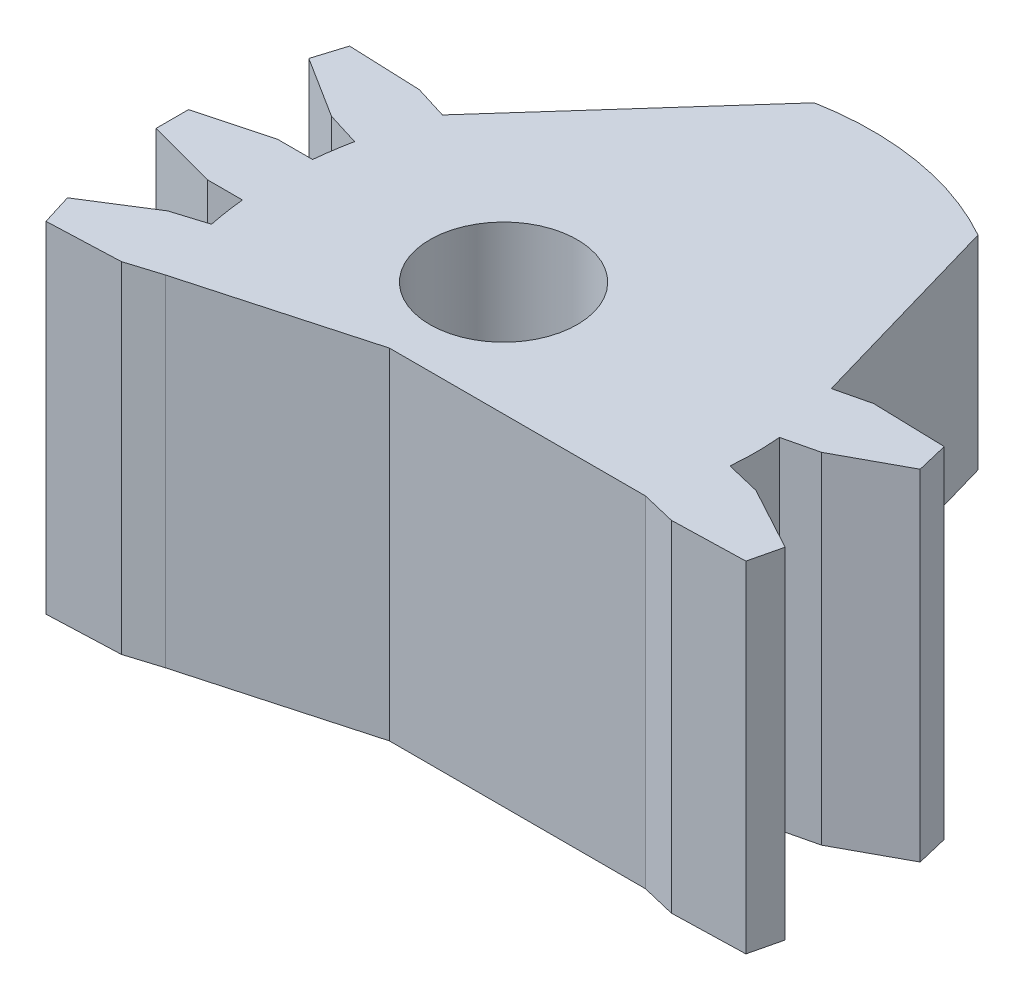
from build123d import *

# Parameters (mm, degrees)
BOSS_EXTRUDE1_DEPTH = 9.7
BOSS_EXTRUDE2_DEPTH = 5.8
CUT_EXTRUDE1_DEPTH  = 15.880557968
BOSS_EXTRUDE3_REACH = 16.881
CUT_EXTRUDE2_DEPTH  = 17.567792011
BOSS_EXTRUDE4_START = -9.7
BOSS_EXTRUDE4_DEPTH = 9.7
BOSS_EXTRUDE5_DEPTH = 5.8


# Read off the part's stored shape, not the designer's step: Boss-Extrude4
with BuildPart() as part:
    # Sketch1 → Boss-Extrude1 (new body)
    with BuildSketch(Plane(origin=(0, 0, 0), x_dir=(1, 0, 0), z_dir=(0, 1, 0))):
        Polygon((6.15, 2.65), (6.15, -2.65), (-1.15, -2.65), (-6.15, -4.038578044), (-6.15, 3.861421956), (-1.15, 3.861421956), align=None)
    extrude(amount=BOSS_EXTRUDE1_DEPTH)

    # Sketch2 → Boss-Extrude2 (add)
    with BuildSketch(Plane.XZ):
        Polygon((-6.15, -3.861421956), (-1.15, -9.461421956), (-1.15, -3.861421956), align=None)
        Polygon((-1.15, -3.861421956), (-1.15, -9.461421956), (4.45, -8.532111962), (4.45, -2.932111962), align=None)
        Polygon((4.45, -2.932111962), (4.45, -8.532111962), (6.15, -2.65), align=None)
    extrude(amount=-BOSS_EXTRUDE2_DEPTH)

    # Sketch3 → Cut-Extrude1 (cut, through all)
    with BuildSketch(Plane(origin=(0, 9.7, 0), x_dir=(1, 0, 0), z_dir=(0, 1, 0))):
        with BuildLine():
            ThreePointArc((0.95, 0.605710978), (0.33492424, 2.090635219), (-1.15, 2.705710978))
            Line((-1.15, 2.705710978), (-1.15, -1.494289022))
            ThreePointArc((-1.15, -1.494289022), (0.33492424, -0.879213262), (0.95, 0.605710978))
        make_face()
        with BuildLine():
            Line((-1.15, -1.494289022), (-1.15, 2.705710978))
            ThreePointArc((-1.15, 2.705710978), (-3.25, 0.605710978), (-1.15, -1.494289022))
        make_face()
    extrude(amount=-CUT_EXTRUDE1_DEPTH, mode=Mode.SUBTRACT)

    # Boss-Extrude3: up to this face of the body (flat: up to its plane)
    boss_extrude3_end = Plane(part.part.faces().sort_by_distance((0.174384558, 0, -2.694350329))[0])
    # Sketch4 → Boss-Extrude3 (add, up to the picked face)
    with BuildSketch(Plane(origin=(0, 9.7, 0), x_dir=(1, 0, 0), z_dir=(0, 1, 0)), mode=Mode.PRIVATE) as boss_extrude3_sk1:
        with BuildLine():
            Line((6.615749123, 0.704986439), (9.533269465, 1.403610124))
            Line((9.533269465, 1.403610124), (9.067520342, 3.348623685))
            Line((9.067520342, 3.348623685), (6.15, 2.65))
            Line((6.15, 2.65), (6.15, -2.65))
            Line((6.15, -2.65), (9.067520342, -3.348623685))
            Line((9.067520342, -3.348623685), (9.533269465, -1.403610124))
            Line((9.533269465, -1.403610124), (6.615749123, -0.704986439))
            ThreePointArc((6.615749123, -0.704986439), (6.65, 0), (6.615749123, 0.704986439))
        make_face()
    boss_extrude3_tool1 = split(extrude(boss_extrude3_sk1.sketch, amount=-BOSS_EXTRUDE3_REACH, mode=Mode.PRIVATE), bisect_by=boss_extrude3_end, keep=Keep.BOTH, mode=Mode.PRIVATE)
    add(boss_extrude3_tool1.solids().sort_by(Axis((6.574967, 9.7, 0), (0, -1, 0)))[0])

    # Sketch5 → Cut-Extrude2 (cut, through all)
    with BuildSketch(Plane(origin=(0, 9.7, 0), x_dir=(1, 0, 0), z_dir=(0, 1, 0))):
        Polygon((9.067520342, 3.348623685), (7.122506781, 2.882874562), (9.192317444, 2.827458872), align=None)
        Polygon((9.408472364, 1.924774937), (7.588255904, 0.937861), (9.533269465, 1.403610124), align=None)
        Polygon((9.408472364, -1.924774937), (9.533269465, -1.403610124), (7.588255904, -0.937861), align=None)
        Polygon((9.192317444, -2.827458872), (7.122506781, -2.882874562), (9.067520342, -3.348623685), align=None)
    extrude(amount=-CUT_EXTRUDE2_DEPTH, mode=Mode.SUBTRACT)

    # Boss-Extrude4 outline → Boss-Extrude4 (add)
    with BuildSketch(Plane(origin=(0, 9.7, 0), x_dir=(1, 0, 0), z_dir=(0, 1, 0)).offset(BOSS_EXTRUDE4_START)):
        with BuildLine():
            Line((-6.900626431, 0.911421956), (-7.900631816, 0.911421956))
            Line((-7.900631816, 0.911421956), (-9.900626719, 0.375520635))
            Line((-9.900626719, 0.375520635), (-9.900626431, -0.552684328))
            Line((-9.900626431, -0.552684328), (-7.900627802, -1.088578044))
            Line((-7.900627802, -1.088578044), (-6.900626431, -1.088578044))
            ThreePointArc((-6.900626431, -1.088578044), (-6.835256527, -1.610578376), (-6.742932214, -2.128491295))
            Line((-6.742932214, -2.128491295), (-7.697979422, -2.424958592))
            Line((-7.697979422, -2.424958592), (-9.449184507, -3.529703076))
            Line((-9.449184507, -3.529703076), (-9.1740036, -4.416177353))
            Line((-9.1740036, -4.416177353), (-7.105039542, -4.335042961))
            Line((-7.105039542, -4.335042961), (-6.15, -4.038578044))
            Line((-6.15, -4.038578044), (-6.15, 3.861421956))
            Line((-6.15, 3.861421956), (-7.105043375, 4.157888063))
            Line((-7.105043375, 4.157888063), (-9.174005832, 4.239014076))
            Line((-9.174005832, 4.239014076), (-9.44918663, 3.35253973))
            Line((-9.44918663, 3.35253973), (-7.697975589, 2.247801314))
            Line((-7.697975589, 2.247801314), (-6.742932214, 1.951335207))
            ThreePointArc((-6.742932214, 1.951335207), (-6.835256527, 1.433422288), (-6.900626431, 0.911421956))
        make_face()
    extrude(amount=BOSS_EXTRUDE4_DEPTH)

    # Sketch8 → Boss-Extrude5 (add)
    with BuildSketch(Plane(origin=(0, 5.8, 0), x_dir=(1, 0, 0), z_dir=(0, 1, 0))):
        with BuildLine():
            ThreePointArc((1.731854671, 9.490021268), (0.289677429, 9.601670434), (-1.15, 9.461421956))
            Line((-1.15, 9.461421956), (1.65, 8.996766959))
            Line((1.65, 8.996766959), (1.731854671, 9.490021268))
        make_face()
        with BuildLine():
            Line((1.731854671, 9.490021268), (1.65, 8.996766959))
            Line((1.65, 8.996766959), (4.45, 8.532111962))
            ThreePointArc((4.45, 8.532111962), (3.132791885, 9.12986067), (1.731854671, 9.490021268))
        make_face()
    extrude(amount=-BOSS_EXTRUDE5_DEPTH)


with BuildPart() as body_2:
    # Mirror1: mirrored copy
    add(part.part.mirror(Plane.ZX))


solid = body_2.part
